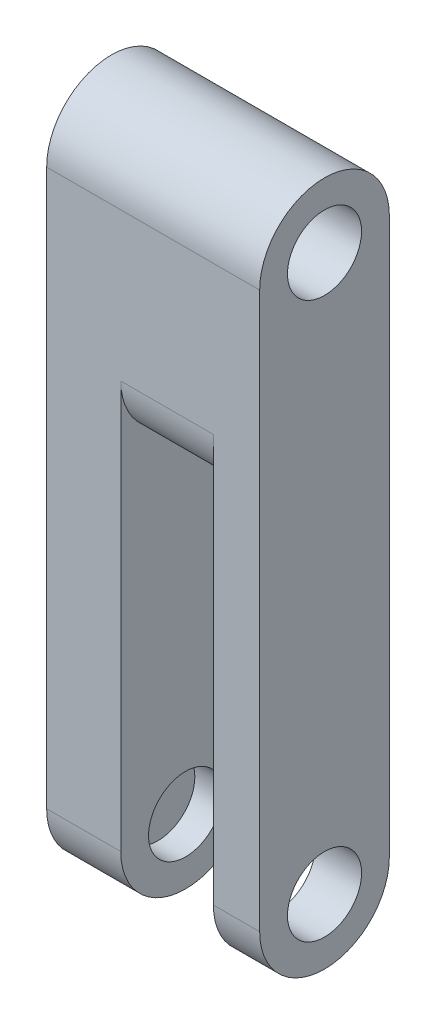
from build123d import *

# Parameters (mm, degrees)
EXTRUDE_1_DEPTH     = 11.5
SKETCH_2_R          = 2
CUT_EXTRUDE_2_DEPTH = 9
CUT_EXTRUDE_3_DEPTH = 5


with BuildPart() as part:
    # Эскиз1 → Бобышка-Вытянуть1 (new body)
    with BuildSketch(Plane(origin=(0, 0, 0), x_dir=(0, 0, -1), z_dir=(1, 0, 0))):
        with BuildLine():
            Line((0, 0), (0, 30))
            ThreePointArc((0, 30), (3.5, 33.5), (7, 30))
            Line((7, 30), (7, 0))
            ThreePointArc((7, 0), (3.5, -3.5), (0, 0))
        make_face()
    extrude(amount=EXTRUDE_1_DEPTH)

    # Эскиз2 → Вырез-Вытянуть2 (cut)
    with BuildSketch(Plane(origin=(11.5, 0, 0), x_dir=(0, 0, -1), z_dir=(1, 0, 0))):
        with Locations((3.5, 30)):
            Circle(SKETCH_2_R)
        with Locations((3.5, 0)):
            Circle(SKETCH_2_R)
    extrude(amount=-CUT_EXTRUDE_2_DEPTH, mode=Mode.SUBTRACT)

    # Эскиз3 → Вырез-Вытянуть3 (cut)
    with BuildSketch(Plane(origin=(4, 0, 0), x_dir=(0, 0, -1), z_dir=(1, 0, 0))):
        with BuildLine():
            Line((0, 22), (-5.973465406, 22))
            Line((-5.973465406, 22), (-5.973465406, -6.207481123))
            Line((-5.973465406, -6.207481123), (11.9268428, -6.207481123))
            Line((11.9268428, -6.207481123), (11.9268428, 22))
            Line((11.9268428, 22), (7, 22))
            ThreePointArc((7, 22), (3.5, 18.5), (0, 22))
        make_face()
    extrude(amount=CUT_EXTRUDE_3_DEPTH, mode=Mode.SUBTRACT)


solid = part.part
